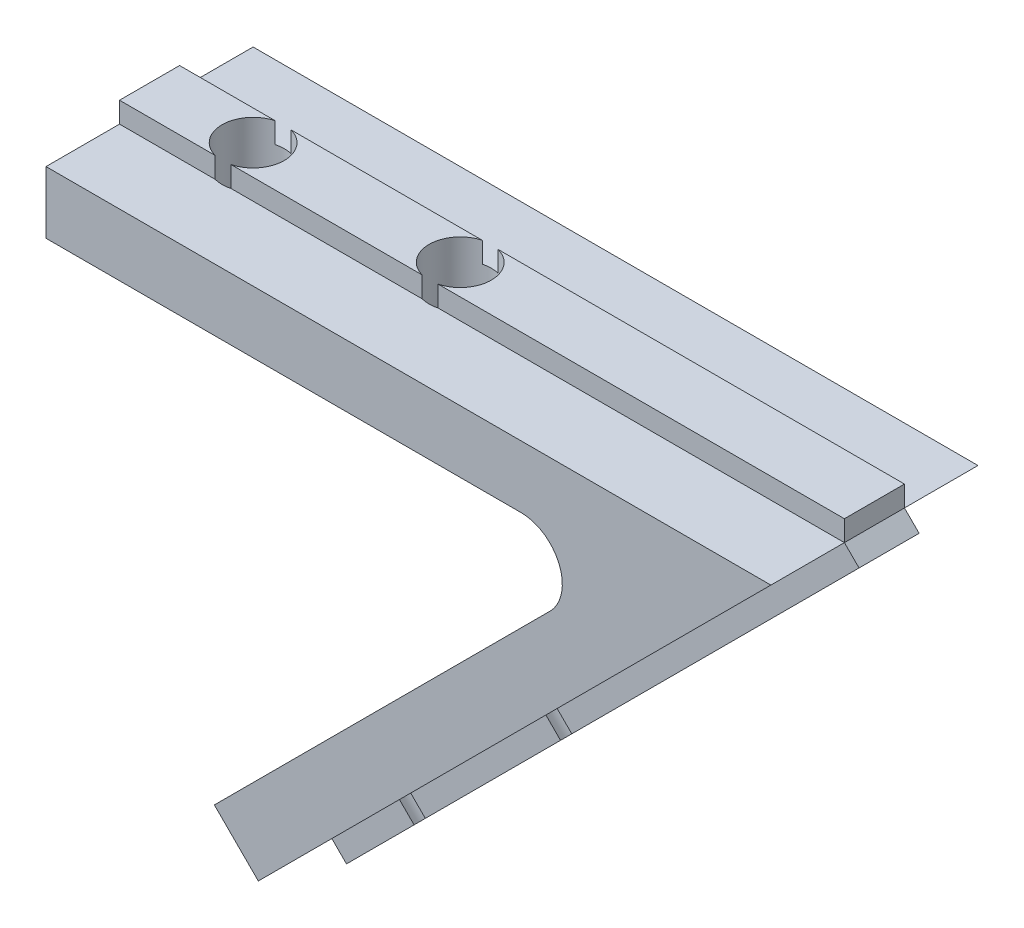
from build123d import *

# Parameters (mm, degrees)
BOSS_EXTRU_1_DEPTH      = 10
ESQUISSE2_W             = 35
ESQUISSE2_H             = 2.9
BOSS_EXTRU_2_DEPTH      = 1
ESQUISSE3_W             = 35
ESQUISSE3_H             = 2.9
BOSS_EXTRU_3_DEPTH      = 1
ESQUISSE4_R             = 1.5
ENL_V_MAT_EXTRU_1_DEPTH = 44.35046032
ESQUISSE5_R             = 1.5
ENL_V_MAT_EXTRU_2_DEPTH = 28.95543054


with BuildPart() as part:
    # Esquisse1 → Boss.-Extru.1 (new body)
    with BuildSketch(Plane.XY):
        with BuildLine():
            Line((0, 0), (35, 0))
            Line((35, 0), (10.251262658, -24.748737342))
            Line((10.251262658, -24.748737342), (8.129942315, -22.627416998))
            Line((8.129942315, -22.627416998), (24.343145751, -6.414213562))
            ThreePointArc((24.343145751, -6.414213562), (24.776691253, -4.234633135), (22.928932188, -3))
            Line((22.928932188, -3), (0, -3))
            Line((0, -3), (0, 0))
        make_face()
    extrude(amount=BOSS_EXTRU_1_DEPTH)

    # Esquisse2 → Boss.-Extru.2 (add)
    with BuildSketch(Plane(origin=(0, 0, 0), x_dir=(1, 0, 0), z_dir=(0, 1, 0))):
        with Locations((17.5, -5)):
            Rectangle(ESQUISSE2_W, ESQUISSE2_H)
    extrude(amount=BOSS_EXTRU_2_DEPTH)

    # Esquisse3 → Boss.-Extru.3 (add)
    with BuildSketch(Plane(origin=(17.5, -17.5, 0), x_dir=(0.7071067811865512, 0.7071067811865439, 0), z_dir=(0.7071067811865439, -0.7071067811865512, 0))):
        with Locations((7.248737342, 5)):
            Rectangle(ESQUISSE3_W, ESQUISSE3_H)
    extrude(amount=BOSS_EXTRU_3_DEPTH)

    # Esquisse4 → Enlèv. mat.-Extru.1 (cut, through all)
    with BuildSketch(Plane.XZ.offset(3)):
        with Locations((5, 5)):
            Circle(ESQUISSE4_R)
        with Locations((15, 5)):
            Circle(ESQUISSE4_R)
    extrude(amount=-ENL_V_MAT_EXTRU_1_DEPTH, mode=Mode.SUBTRACT)

    # Esquisse5 → Enlèv. mat.-Extru.2 (cut, through all)
    with BuildSketch(Plane(origin=(15.378679656, -15.378679656, 0), x_dir=(0.7071067811865511, 0.707106781186544, 0), z_dir=(-0.707106781186544, 0.7071067811865511, 0))):
        with Locations((-5.251262658, -5)):
            Circle(ESQUISSE5_R)
        with Locations((4.748737342, -5)):
            Circle(ESQUISSE5_R)
    extrude(amount=-ENL_V_MAT_EXTRU_2_DEPTH, mode=Mode.SUBTRACT)


solid = part.part
